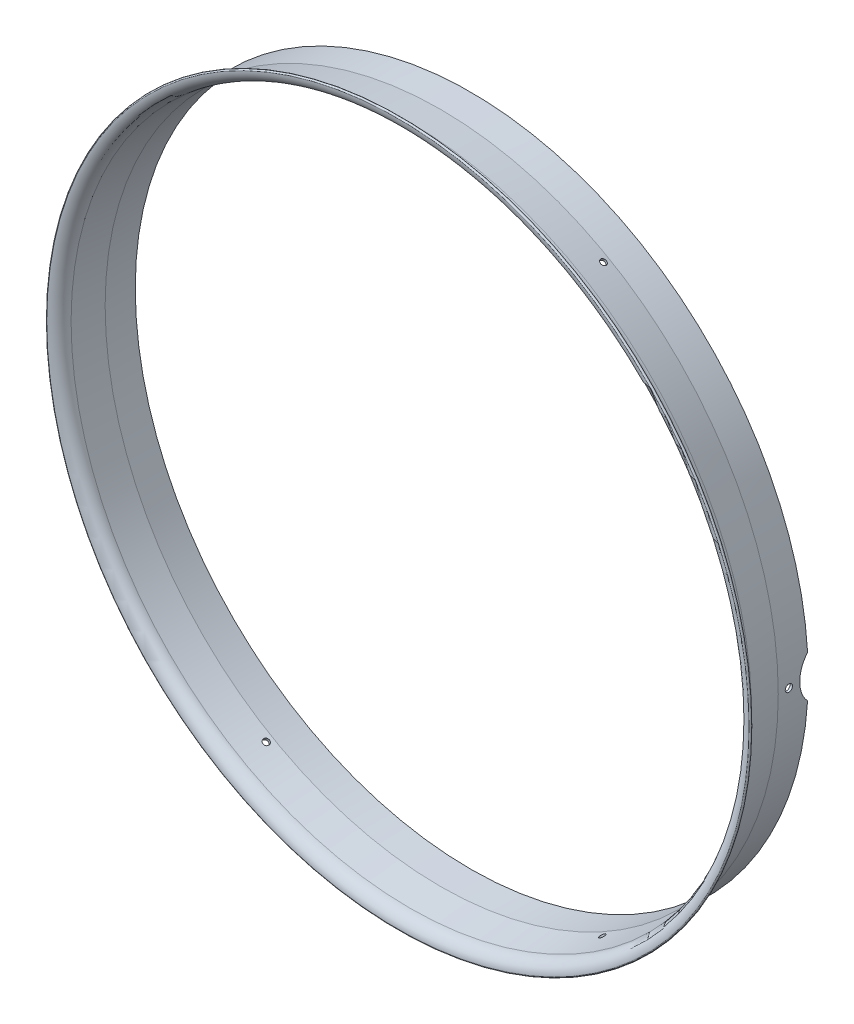
from build123d import *

# Parameters (mm, degrees)
CUT_THICKEN1_START             = -161.779064873
CUT_THICKEN1_DEPTH             = 1.271941736
F_3_0_3_DIAMETER_HOLE1_D       = 3
F_3_0_3_DIAMETER_HOLE1_DEPTH   = 6.997347225
F_2_5_2_5_DIAMETER_HOLE1_D     = 2.5
F_2_5_2_5_DIAMETER_HOLE1_DEPTH = 60.082245303
F_2_5_2_5_DIAMETER_HOLE2_D     = 2.5
F_2_5_2_5_DIAMETER_HOLE2_DEPTH = 338.689419568


# Read off the part's stored shape, not the designer's step: Cut-Thicken1
with BuildPart() as part:
    # Sketch1 → Revolve1 (revolve)
    with BuildSketch(Plane(origin=(-300, 0, 0), x_dir=(0, -1, 0), z_dir=(-1, 0, 0)), mode=Mode.PRIVATE) as revolve1_sk:
        with BuildLine():
            Line((-527.332012287, -352.357743681), (-528.839135448, -364.91710336))
            Line((-528.839135448, -364.91710336), (-528.839135448, -377.357743681))
            Line((-528.839135448, -377.357743681), (-527.839135448, -377.357743681))
            Line((-527.839135448, -377.357743681), (-527.839135448, -364.976888902))
            Line((-527.839135448, -364.976888902), (-526.339135448, -352.476888902))
            ThreePointArc((-526.339135448, -352.476888902), (-525.203611847, -349.572885006), (-522.332012286, -348.357743681))
            ThreePointArc((-522.332012286, -348.357743681), (-521.849911622, -347.857743681), (-522.332012286, -347.357743681))
            ThreePointArc((-522.332012286, -347.357743681), (-525.867546192, -348.822209775), (-527.332012287, -352.357743681))
        make_face()
    revolve(revolve1_sk.sketch.rotate(Axis((-300, 667.332012286, -347.075887645), (0, 0, -1)), 90), axis=Axis((-300, 667.332012286, -347.075887645), (0, 0, -1)))

    # Cut-Thicken1 outline → Cut-Thicken1 (cut)
    with BuildSketch(Plane.YZ.offset(CUT_THICKEN1_START)):
        with BuildLine():
            ThreePointArc((676.006688073, -377.357743681), (667.332012287, -373.857743681), (658.6573365, -377.357743681))
            Line((658.6573365, -377.357743681), (676.006688073, -377.357743681))
        make_face()
    extrude(amount=CUT_THICKEN1_DEPTH, mode=Mode.SUBTRACT)

    # Ø3.0 (3) Diameter Hole1
    with Locations(Plane.ZY.offset(161.515246561)):
        with Locations((-369.357743681, 667.332012286)):
            Hole(F_3_0_3_DIAMETER_HOLE1_D / 2, depth=F_3_0_3_DIAMETER_HOLE1_DEPTH)

    # Ø2.5 (2.5) Diameter Hole1
    with Locations(Plane(origin=(-294.638237699, 510.328397547, 0), x_dir=(0.866025403784442, 0.4999999999999941, 0), z_dir=(-0.49999999999999417, 0.8660254037844421, 0))):
        with Locations((73.858385008, 362.357743681)):
            Hole(F_2_5_2_5_DIAMETER_HOLE1_D / 2, depth=F_2_5_2_5_DIAMETER_HOLE1_DEPTH)

    # Ø2.5 (2.5) Diameter Hole2
    with Locations(Plane(origin=(283.941824832, 491.801667003, 0), x_dir=(0.8660254037844352, -0.5000000000000062, 0), z_dir=(0.5000000000000061, 0.866025403784435, 0))):
        with Locations((-593.473627278, 362.357743681)):
            Hole(F_2_5_2_5_DIAMETER_HOLE2_D / 2, depth=F_2_5_2_5_DIAMETER_HOLE2_DEPTH)


solid = part.part
